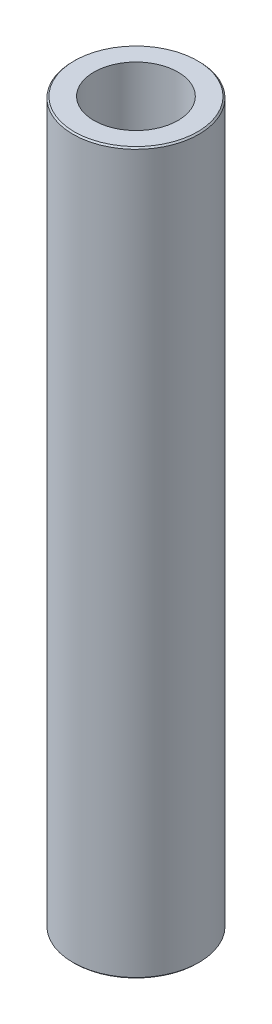
from build123d import *

# Parameters (mm, degrees)
SKETCH1_R           = 52.5
BOSS_EXTRUDE1_DEPTH = 600
SKETCH2_R           = 35.008918692
CUT_EXTRUDE1_DEPTH  = 605.576297914
CHAMFER1_SIZE       = 1.181680531


with BuildPart() as part:
    # Sketch1 → Boss-Extrude1 (new body)
    with BuildSketch(Plane(origin=(0, 0, 0), x_dir=(1, 0, 0), z_dir=(0, 1, 0))):
        Circle(SKETCH1_R)
    extrude(amount=BOSS_EXTRUDE1_DEPTH)

    # Sketch2 → Cut-Extrude1 (cut, through all)
    with BuildSketch(Plane(origin=(0, 0, 0), x_dir=(1, 0, 0), z_dir=(0, 1, 0))):
        Circle(SKETCH2_R)
    extrude(amount=CUT_EXTRUDE1_DEPTH, mode=Mode.SUBTRACT)

    # Chamfer1
    chamfer1_edges = [part.edges().sort_by_distance(p)[0] for p in [
        (-52.5, 600, 0),
        (-52.5, 0, 0),
    ]]
    chamfer(chamfer1_edges, length=CHAMFER1_SIZE)


solid = part.part
